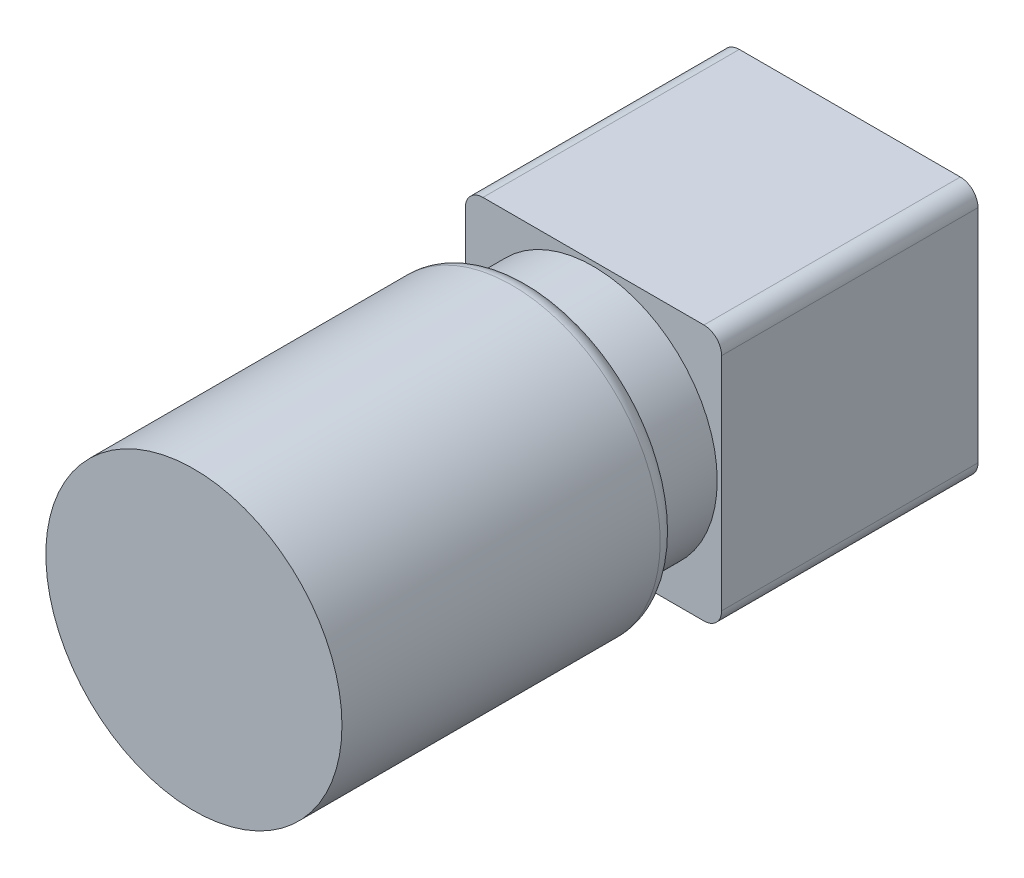
from build123d import *

# Parameters (mm, degrees)
SKETCH_1_W             = 29
SKETCH_1_H             = 29
EXTRUDE_1_DEPTH        = 29
SKETCH_2_R             = 14
EXTRUDE_2_DEPTH        = 7.2
HOLE_WIZARD_M3_1_D     = 2.5
HOLE_WIZARD_M3_1_DEPTH = 7.5
HOLE_WIZARD_M3_1_TIP   = 0.751075774
SKETCH_6_R             = 16.75
EXTRUDE_3_DEPTH        = 38
FILLET_1_R             = 2
SKETCH_7_W             = 22
SKETCH_7_H             = 4
EXTRUDE_4_DEPTH        = 3.5
FILLET_2_R             = 2


with BuildPart() as part:
    # 草图1 → 凸台-拉伸1 (new body)
    with BuildSketch(Plane.XY):
        Rectangle(SKETCH_1_W, SKETCH_1_H)
    extrude(amount=EXTRUDE_1_DEPTH)

    # 草图2 → 凸台-拉伸2 (add)
    with BuildSketch(Plane.XY.offset(29)):
        Circle(SKETCH_2_R)
    extrude(amount=EXTRUDE_2_DEPTH)

    # M3 螺纹孔1
    with Locations(Plane(origin=(0, -14.5, 0), x_dir=(-1, 0, 0), z_dir=(0, -1, 0))):
        with Locations((10, -25.5), (-10, -25.5)):
            Hole(HOLE_WIZARD_M3_1_D / 2, depth=HOLE_WIZARD_M3_1_DEPTH)
            with Locations((0, 0, -(HOLE_WIZARD_M3_1_DEPTH + HOLE_WIZARD_M3_1_TIP / 2))):  # 118° drill point
                Cone(0, HOLE_WIZARD_M3_1_D / 2, HOLE_WIZARD_M3_1_TIP, mode=Mode.SUBTRACT)

    # 草图6 → 凸台-拉伸3 (add)
    with BuildSketch(Plane.XY.offset(36.2)):
        Circle(SKETCH_6_R)
    extrude(amount=EXTRUDE_3_DEPTH)

    # 圆角1
    fillet_1_edges = [part.edges().sort_by_distance(p)[0] for p in [
        (-16.75, 0, 36.2),
        (-14.5, 14.5, 14.5),
        (14.5, 14.5, 14.5),
        (14.5, -14.5, 14.5),
        (-14.5, -14.5, 14.5),
    ]]
    fillet(fillet_1_edges, radius=FILLET_1_R)

    # 草图7 → 凸台-拉伸4 (add)
    with BuildSketch(Plane(origin=(0, 0, 0), x_dir=(-1, 0, 0), z_dir=(0, 0, -1))):
        with Locations((0, 9)):
            Rectangle(SKETCH_7_W, SKETCH_7_H)
    extrude(amount=EXTRUDE_4_DEPTH)

    # 圆角2
    fillet_2_edges = [part.edges().sort_by_distance(p)[0] for p in [
        (-11, 7, -1.75),
        (-11, 11, -1.75),
        (11, 7, -1.75),
        (11, 11, -1.75),
    ]]
    fillet(fillet_2_edges, radius=FILLET_2_R - 0.0001)  # a hair under: the kernel refuses the full size


solid = part.part
